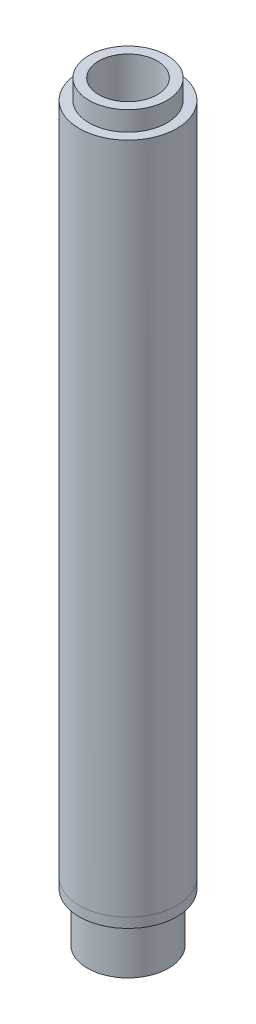
from build123d import *

# Parameters (mm, degrees)
SKETCH1_R           = 12.7
BOSS_EXTRUDE1_DEPTH = 177.8
SKETCH4_R           = 10.16
BOSS_EXTRUDE2_DEPTH = 5.08
SKETCH5_R           = 7.62
CUT_EXTRUDE1_DEPTH  = 184.759828036
SKETCH6_R           = 10.541
SKETCH6_R_2         = 7.62
BOSS_EXTRUDE3_DEPTH = 12.7


with BuildPart() as part:
    # Sketch1 → Boss-Extrude1 (new body)
    with BuildSketch(Plane(origin=(0, 0, 0), x_dir=(1, 0, 0), z_dir=(0, 1, 0))):
        Circle(SKETCH1_R)
    extrude(amount=BOSS_EXTRUDE1_DEPTH)

    # Sketch4 → Boss-Extrude2 (add)
    with BuildSketch(Plane(origin=(0, 177.8, 0), x_dir=(1, 0, 0), z_dir=(0, 1, 0))):
        Circle(SKETCH4_R)
    extrude(amount=BOSS_EXTRUDE2_DEPTH)

    # Sketch5 → Cut-Extrude1 (cut, through all)
    with BuildSketch(Plane(origin=(0, 182.88, 0), x_dir=(1, 0, 0), z_dir=(0, 1, 0))):
        Circle(SKETCH5_R)
    extrude(amount=-CUT_EXTRUDE1_DEPTH, mode=Mode.SUBTRACT)

    # Sketch6 → Boss-Extrude3 (add)
    with BuildSketch(Plane.XZ):
        Circle(SKETCH6_R)
        Circle(SKETCH6_R_2, mode=Mode.SUBTRACT)
    extrude(amount=BOSS_EXTRUDE3_DEPTH)


with BuildPart() as body_2:
    # Split1: the piece on the far side of the plane
    add(part.part)
    split(bisect_by=Plane(origin=(0, 2.54, 0), x_dir=(0, 0, -1), z_dir=(0, -1, 0)), keep=Keep.BOTTOM)


with BuildPart() as part_1:
    add(part.part)

    # Split1
    split(bisect_by=Plane(origin=(0, 2.54, 0), x_dir=(0, 0, -1), z_dir=(0, -1, 0)), keep=Keep.TOP)


solid = Compound([body_2.part, part_1.part])
